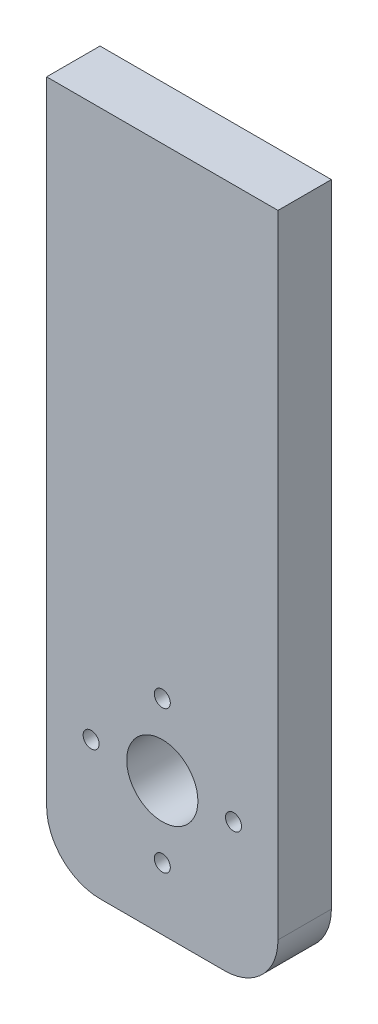
from build123d import *

# Parameters (mm, degrees)
ESQUISSE1_R        = 0.9
ESQUISSE1_R_2      = 4
BOSS_EXTRU_1_DEPTH = 6


with BuildPart() as part:
    # Esquisse1 → Boss.-Extru.1 (new body)
    with BuildSketch(Plane.XY):
        with BuildLine():
            Line((24.916434397, -77.573457495), (24.916434397, -6.573457495))
            Line((24.916434397, -6.573457495), (50.916434397, -6.573457495))
            Line((50.916434397, -6.573457495), (50.916434397, -77.573457495))
            ThreePointArc((50.916434397, -77.573457495), (49.159075085, -81.816098182), (44.916434397, -83.573457495))
            Line((44.916434397, -83.573457495), (30.916434397, -83.573457495))
            ThreePointArc((30.916434397, -83.573457495), (26.67379371, -81.816098182), (24.916434397, -77.573457495))
        make_face()
        with Locations((29.916434397, -68.573457495)):
            Circle(ESQUISSE1_R, mode=Mode.SUBTRACT)
        with Locations((37.916434397, -60.573457495)):
            Circle(ESQUISSE1_R, mode=Mode.SUBTRACT)
        with Locations((45.916434397, -68.573457495)):
            Circle(ESQUISSE1_R, mode=Mode.SUBTRACT)
        with Locations((37.916434397, -76.573457495)):
            Circle(ESQUISSE1_R, mode=Mode.SUBTRACT)
        with Locations((37.916434397, -68.573457495)):
            Circle(ESQUISSE1_R_2, mode=Mode.SUBTRACT)
    extrude(amount=BOSS_EXTRU_1_DEPTH)


solid = part.part
